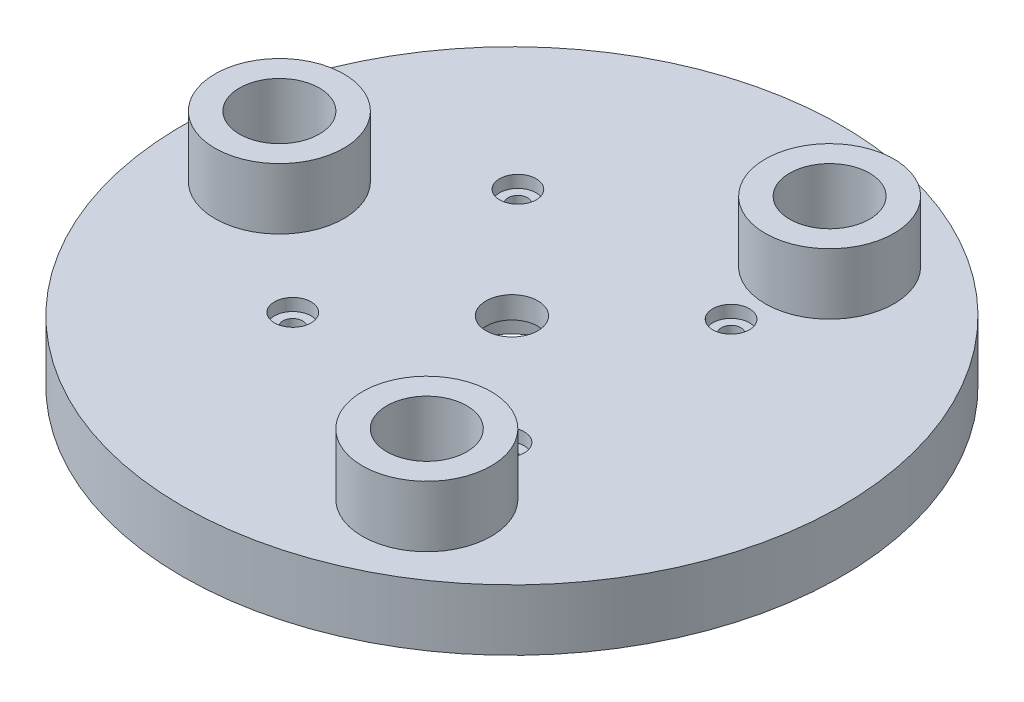
from build123d import *

# Parameters (mm, degrees)
SKETCH2_R               = 27
SKETCH2_R_2             = 2.125
BOSS_EXTRUDE2_DEPTH     = 10
SKETCH3_R               = 3.275
CUT_EXTRUDE1_DEPTH      = 7.5
CUT_EXTRUDE2_START      = -5
SKETCH4_R               = 27
SKETCH4_R_2             = 5.275
CUT_EXTRUDE2_DEPTH      = 5
SKETCH5_R               = 5.25
CUT_EXTRUDE3_DEPTH      = 3.2
CUT_EXTRUDE4_DEPTH      = 39.509739028
CUT_EXTRUDE4_DEPTH_BACK = 39.509739028
SKETCH6_R               = 0.8
SKETCH7_R               = 1.500000048
CUT_EXTRUDE5_DEPTH      = 1


with BuildPart() as part:
    # Sketch2 → Boss-Extrude2 (new body)
    with BuildSketch(Plane(origin=(0, 0, 0), x_dir=(1, 0, 0), z_dir=(0, 1, 0))):
        Circle(SKETCH2_R)
        Circle(SKETCH2_R_2, mode=Mode.SUBTRACT)
    extrude(amount=BOSS_EXTRUDE2_DEPTH)

    # Sketch3 → Cut-Extrude1 (cut)
    with BuildSketch(Plane.XZ.offset(-10)):
        with Locations((9.52625, -16.499949006)):
            Circle(SKETCH3_R)
        with Locations((9.52625, 16.499949006)):
            Circle(SKETCH3_R)
        with Locations((-19.0525, 0)):
            Circle(SKETCH3_R)
    extrude(amount=CUT_EXTRUDE1_DEPTH, mode=Mode.SUBTRACT)

    # Sketch4 → Cut-Extrude2 (cut)
    with BuildSketch(Plane(origin=(0, 10, 0), x_dir=(1, 0, 0), z_dir=(0, 1, 0)).offset(CUT_EXTRUDE2_START)):
        Circle(SKETCH4_R)
        with Locations((-19.0525, 0)):
            Circle(SKETCH4_R_2, mode=Mode.SUBTRACT)
        with Locations((9.52625, -16.499949006)):
            Circle(SKETCH4_R_2, mode=Mode.SUBTRACT)
        with Locations((9.52625, 16.499949006)):
            Circle(SKETCH4_R_2, mode=Mode.SUBTRACT)
    extrude(amount=CUT_EXTRUDE2_DEPTH, mode=Mode.SUBTRACT)

    # Sketch5 → Cut-Extrude3 (cut)
    with BuildSketch(Plane.XZ):
        Circle(SKETCH5_R)
    extrude(amount=-CUT_EXTRUDE3_DEPTH, mode=Mode.SUBTRACT)

    # Sketch6 → Cut-Extrude4 (cut, two sides: drawn at the far end of the back side and taken through both)
    with BuildSketch(Plane(origin=(0, 5, 0), x_dir=(1, 0, 0), z_dir=(0, 1, 0)).offset(-CUT_EXTRUDE4_DEPTH_BACK)):
        with Locations((-8.733127343, 9.220763895)):
            Circle(SKETCH6_R)
        with Locations((9.220763895, 8.733127343)):
            Circle(SKETCH6_R)
        with Locations((8.733127343, -9.220763895)):
            Circle(SKETCH6_R)
        with Locations((-9.220763895, -8.733127343)):
            Circle(SKETCH6_R)
    extrude(amount=CUT_EXTRUDE4_DEPTH + CUT_EXTRUDE4_DEPTH_BACK, mode=Mode.SUBTRACT)

    # Sketch7 → Cut-Extrude5 (cut)
    with BuildSketch(Plane(origin=(0, 5, 0), x_dir=(1, 0, 0), z_dir=(0, 1, 0))):
        with Locations((-8.733127343, 9.220763895)):
            Circle(SKETCH7_R)
        with Locations((9.220763895, 8.733127343)):
            Circle(SKETCH7_R)
        with Locations((8.733127343, -9.220763895)):
            Circle(SKETCH7_R)
        with Locations((-9.220763895, -8.733127343)):
            Circle(SKETCH7_R)
    extrude(amount=-CUT_EXTRUDE5_DEPTH, mode=Mode.SUBTRACT)


solid = part.part
